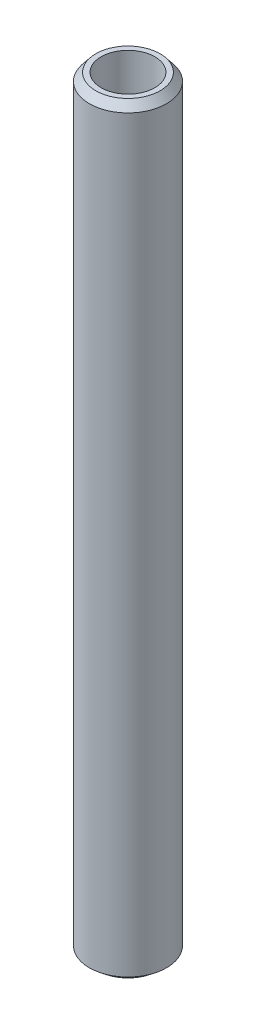
from build123d import *
from OCP.BRepFilletAPI import BRepFilletAPI_MakeChamfer

# Parameters (mm, degrees)
SKETCH1_R           = 22.5
BOSS_EXTRUDE1_DEPTH = 444.679747438
SKETCH2_R           = 15.658740592
CUT_EXTRUDE1_DEPTH  = 446.81675359
CHAMFER1_SIZE       = 4.647652149
CHAMFER1_SIZE2      = 3.764442237


with BuildPart() as part:
    # Sketch1 → Boss-Extrude1 (new body)
    with BuildSketch(Plane(origin=(0, 0, 0), x_dir=(1, 0, 0), z_dir=(0, 1, 0))):
        Circle(SKETCH1_R)
    extrude(amount=BOSS_EXTRUDE1_DEPTH)

    # Sketch2 → Cut-Extrude1 (cut, through all)
    with BuildSketch(Plane(origin=(0, 0, 0), x_dir=(1, 0, 0), z_dir=(0, 1, 0))):
        Circle(SKETCH2_R)
    extrude(amount=CUT_EXTRUDE1_DEPTH, mode=Mode.SUBTRACT)

    # Chamfer1: one chamfer whose edges measure the first distance from different faces: ONE call of the kernel's chamfer builder (chamfer() names one face for all edges)
    chamfer1_edges_1 = [part.edges().sort_by_distance(p)[0] for p in [
        (-22.5, 444.679747438, 0),
    ]]
    chamfer1_side_1 = [part.faces().sort_by_distance(p)[0] for p in [
        (-22.5, 222.339873719, 0),
    ]]
    chamfer1_edges_2 = [part.edges().sort_by_distance(p)[0] for p in [
        (-22.5, 0, 0),
    ]]
    chamfer1_side_2 = [part.faces().sort_by_distance(p)[0] for p in [
        (-21.863603897, 0, 0),
    ]]
    chamfer1 = BRepFilletAPI_MakeChamfer(part.part.solid().wrapped)
    for e in chamfer1_edges_1:
        chamfer1.Add(CHAMFER1_SIZE, CHAMFER1_SIZE2, e.wrapped, chamfer1_side_1[0].wrapped)  # the first distance lies on this face
    for e in chamfer1_edges_2:
        chamfer1.Add(CHAMFER1_SIZE, CHAMFER1_SIZE2, e.wrapped, chamfer1_side_2[0].wrapped)  # the first distance lies on this face
    add(Compound.cast(chamfer1.Shape()), mode=Mode.REPLACE)


solid = part.part
